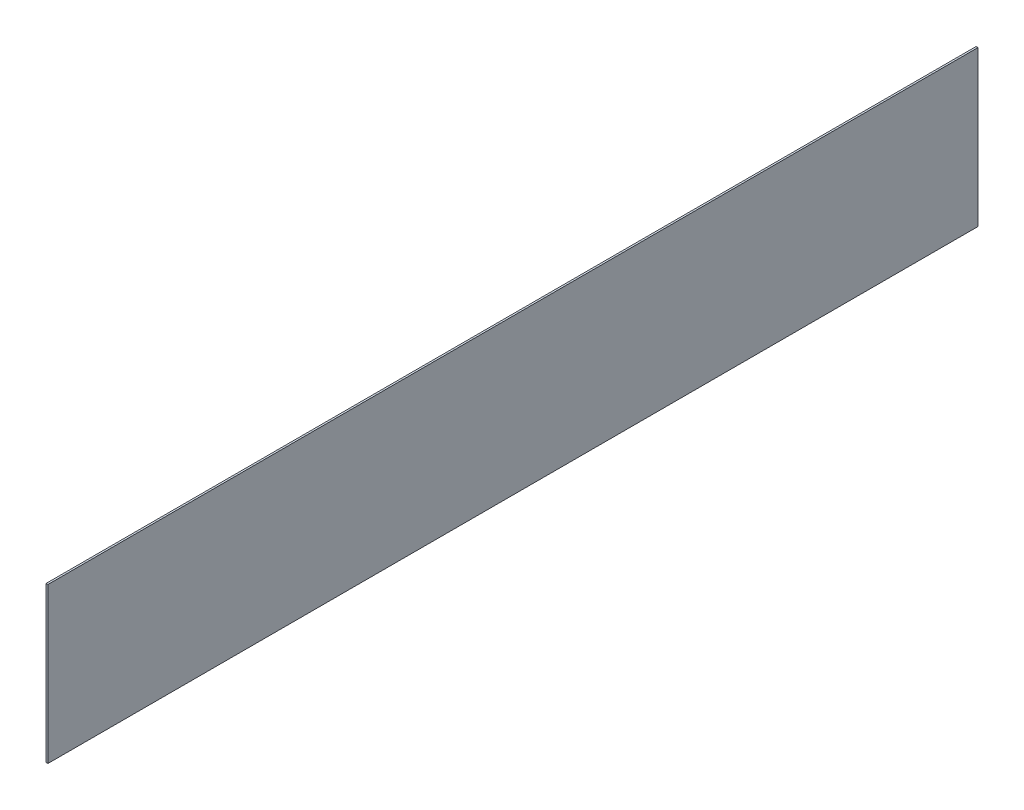
from build123d import *

# Parameters (mm, degrees)
SKETCH1_W           = 457.2
SKETCH1_H           = 76.2
BOSS_EXTRUDE1_DEPTH = 0.456


with BuildPart() as part:
    # Sketch1 → Boss-Extrude1 (new, symmetric)
    with BuildSketch(Plane(origin=(0, 0, 0), x_dir=(0, 0, -1), z_dir=(1, 0, 0))):
        with Locations((0, 38.1)):
            Rectangle(SKETCH1_W, SKETCH1_H)
    extrude(amount=BOSS_EXTRUDE1_DEPTH, both=True)


solid = part.part
